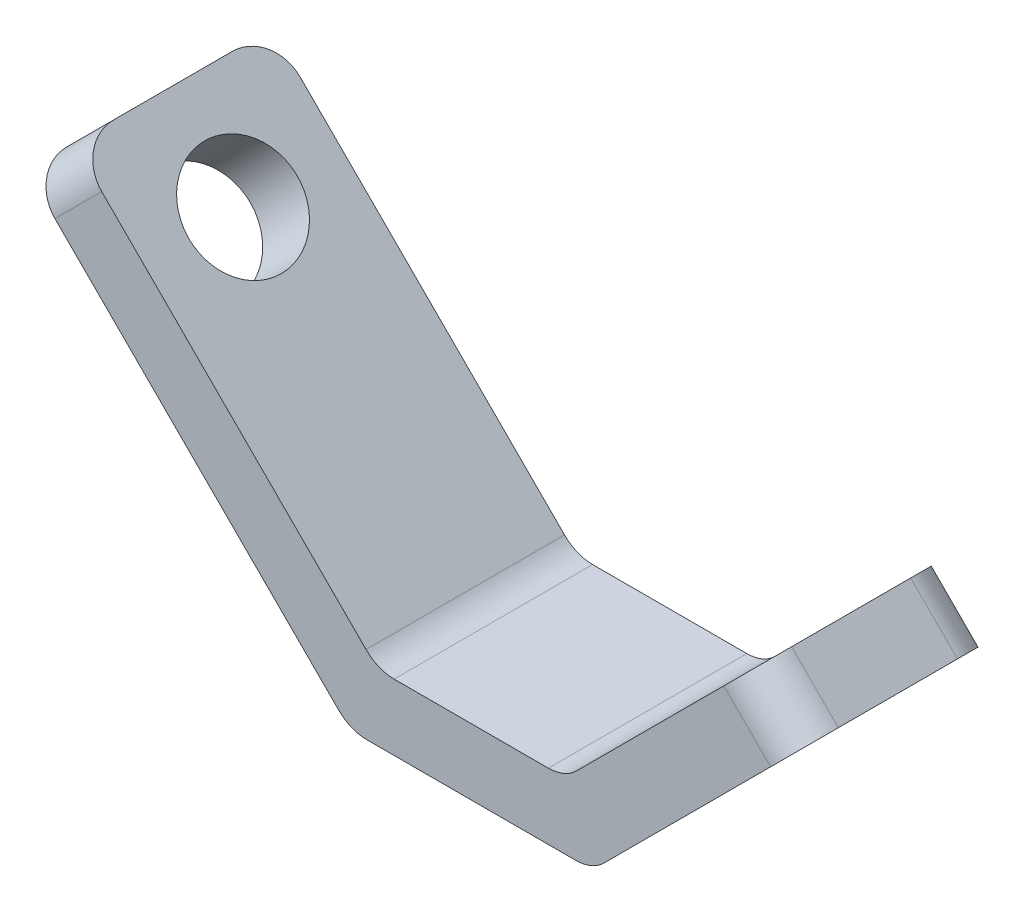
from build123d import *

# Parameters (mm, degrees)
EXTRUDE_1_DEPTH          = 7.5
CUT_EXTRUDE_1_DEPTH      = 45.584481316
CUT_EXTRUDE_1_DEPTH_BACK = 45.584481316
SKETCH_2_R               = 4.1
CUT_EXTRUDE_2_DEPTH      = 51.621141828
CUT_EXTRUDE_2_DEPTH_BACK = 51.621141828
SKETCH_3_R               = 4.1
FILLET_1_R               = 3


with BuildPart() as part:
    # ｽｹｯﾁ1 → ﾎﾞｽ - 押し出し1 (new, symmetric)
    with BuildSketch(Plane.XY):
        Polygon((0, 0), (-24.445436483, 24.445436483), (-20.909902577, 27.980970389), (2.071067812, 5), (16.213203436, 5), (30.355339059, 19.142135624), (33.890872965, 15.606601718), (18.284271247, 0), align=None)
    extrude(amount=EXTRUDE_1_DEPTH, both=True)

    # ｽｹｯﾁ2 → ｶｯﾄ - 押し出し1 (cut, two sides: drawn at the far end of the back side and taken through both)
    with BuildSketch(Plane(origin=(0, 0, 0), x_dir=(0, 0, 1), z_dir=(-0.7071067811865487, -0.7071067811865464, 0)).offset(-CUT_EXTRUDE_1_DEPTH_BACK)):
        with Locations((0, 27.071067812)):
            Circle(SKETCH_2_R)
    extrude(amount=CUT_EXTRUDE_1_DEPTH + CUT_EXTRUDE_1_DEPTH_BACK, mode=Mode.SUBTRACT)

    # ｽｹｯﾁ3 → ｶｯﾄ - 押し出し2 (cut, two sides: drawn at the far end of the back side and taken through both)
    with BuildSketch(Plane(origin=(9.142135624, -9.142135624, 0), x_dir=(0, 0, -1), z_dir=(0.707106781186549, -0.7071067811865461, 0)).offset(-CUT_EXTRUDE_2_DEPTH_BACK)):
        with Locations((0, 27.5)):
            Circle(SKETCH_3_R)
    extrude(amount=CUT_EXTRUDE_2_DEPTH + CUT_EXTRUDE_2_DEPTH_BACK, mode=Mode.SUBTRACT)

    # ﾌｨﾚｯﾄ1
    fillet_1_edges = [part.edges().sort_by_distance(p)[0] for p in [
        (32.123106012, 17.374368671, -7.5),
        (32.123106012, 17.374368671, 7.5),
        (-22.67766953, 26.213203436, -7.5),
        (-22.67766953, 26.213203436, 7.5),
        (18.284271247, 0, 0),
        (0, 0, 0),
        (16.213203436, 5, 0),
        (2.071067812, 5, 0),
    ]]
    fillet(fillet_1_edges, radius=FILLET_1_R)


solid = part.part
